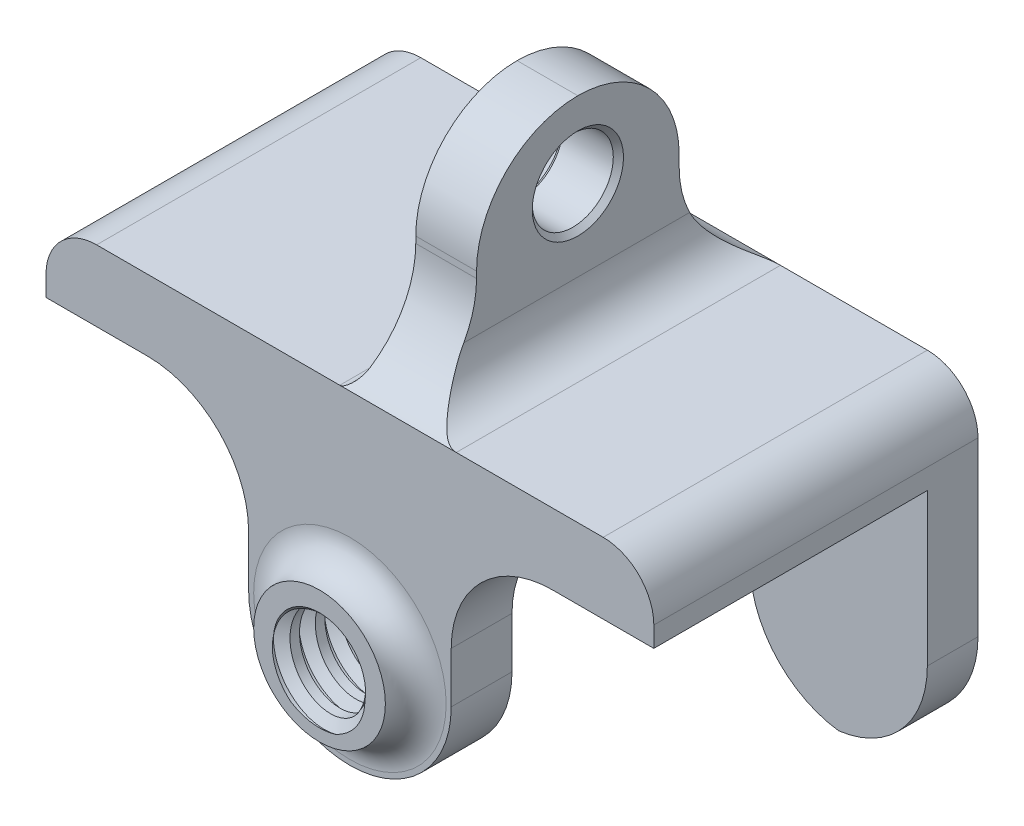
from build123d import *

# Parameters (mm, degrees)
BOSS_EXTRUDE1_DEPTH    = 60
SKETCH2_W              = 6
SKETCH2_H              = 20
BOSS_EXTRUDE3_DEPTH    = 20
FILLET1_R              = 10
SKETCH11_R             = 6.5
BOSS_EXTRUDE4_DEPTH    = 3
SKETCH15_R             = 3.75
CUT_EXTRUDE3_DEPTH     = 9
CHAMFER3_SIZE          = 0.8
CUT_SWEEP1_PITCH       = 2.5
M10X1_5_TAPPED_HOLE1_D = 8.5
FILLET7_R              = 3
M8X1_25_TAPPED_HOLE1_D = 8
CHAMFER2_SIZE          = 0.5
SKETCH9_W              = 20
SKETCH9_H              = 25
CUT_EXTRUDE1_DEPTH     = 6
FILLET3_R              = 10
SKETCH10_W             = 25
SKETCH10_H             = 25
CUT_EXTRUDE2_DEPTH     = 5
FILLET4_R              = 10
FILLET5_R              = 5
FILLET6_R              = 1
FILLET8_R              = 4.5


with BuildPart() as part:
    # Sketch1 → Boss-Extrude1 (new body)
    with BuildSketch(Plane(origin=(0, 0, 0), x_dir=(0, 0, -1), z_dir=(1, 0, 0))):
        Polygon((10.5, 0), (15.5, 0), (15.5, 32), (-16.5, 32), (-16.5, 0), (-10.5, 0), (-10.5, 25), (10.5, 25), align=None)
    extrude(amount=BOSS_EXTRUDE1_DEPTH)

    # Sketch2 → Boss-Extrude3 (add)
    with BuildSketch(Plane(origin=(0, 32, 0), x_dir=(1, 0, 0), z_dir=(0, 1, 0))):
        with Locations((33, 0)):
            Rectangle(SKETCH2_W, SKETCH2_H)
    extrude(amount=BOSS_EXTRUDE3_DEPTH)

    # Fillet1
    # the kernel refuses this fillet: 10 mm, written as the material it adds along each edge
    with BuildSketch(Plane(origin=(36, 32, -10), x_dir=(0, 0, -1), z_dir=(-1, 0, 0))) as fillet1_piece_1:
        with BuildLine():
            CenterArc((10, -8.93028555), FILLET1_R, 116.74368395, 63.25631605)
            Line((0, -8.93028555), (0, 0))
            Line((0, 0), (5.5, 0))
        make_face()
    extrude(amount=6)
    with BuildSketch(Plane(origin=(30, 32, 10), x_dir=(0, 0, 1), z_dir=(1, 0, 0))) as fillet1_piece_2:
        with BuildLine():
            CenterArc((10, -9.367496998), FILLET1_R, 110.487315115, 69.512684885)
            Line((0, -9.367496998), (0, 0))
            Line((0, 0), (6.5, 0))
        make_face()
    extrude(amount=6)
    # the kernel refuses this fillet: 10 mm, written as the material it takes off along each edge
    with BuildSketch(Plane(origin=(5, 52, 10), x_dir=(0, 0, -1), z_dir=(1, 0, 0))) as fillet1_2_piece_1:
        with BuildLine():
            CenterArc((FILLET1_R, -FILLET1_R), FILLET1_R, 90, 90)
            Line((0, -FILLET1_R), (0, 0))
            Line((0, 0), (FILLET1_R, 0))
        make_face()
    extrude(amount=56, mode=Mode.SUBTRACT)
    with BuildSketch(Plane(origin=(61, 52, -10), x_dir=(0, -1, 0), z_dir=(-1, 0, 0))) as fillet1_2_piece_2:
        with BuildLine():
            CenterArc((FILLET1_R, FILLET1_R), FILLET1_R, 180, 90)
            Line((0, FILLET1_R), (0, 0))
            Line((0, 0), (FILLET1_R, 0))
        make_face()
    extrude(amount=56, mode=Mode.SUBTRACT)

    # Sketch11 → Boss-Extrude4 (add)
    with BuildSketch(Plane.XY.offset(16.5)):
        with Locations(Location((30, 10, 0), (0, 0, 180))):
            Circle(SKETCH11_R)
    extrude(amount=BOSS_EXTRUDE4_DEPTH)

    # Sketch15 → Cut-Extrude3 (cut)
    with BuildSketch(Plane.XY.offset(19.5)):
        with Locations((30, 10)):
            Circle(SKETCH15_R)
    extrude(amount=-CUT_EXTRUDE3_DEPTH, mode=Mode.SUBTRACT)

    # Chamfer3
    chamfer3_edges = [part.edges().sort_by_distance(p)[0] for p in [
        (26.25, 10, 10.5),
        (26.25, 10, 19.5),
    ]]
    chamfer(chamfer3_edges, length=CHAMFER3_SIZE)

    # Cut-Sweep1: arcs per turn and ends read off the stored shape
    # Cut-Sweep1: the profile of Sketch17 screwed along a right-hand helix through 6 turns, 10 arcs to a turn; built about Z, then put on its axis
    cut_sweep1_z = Axis((0, 0, 0), (0, 0, 1))
    cut_sweep1_corners = [(3.74766594, 3.74766594, -1.126794919), (3.74766594, 3.74766594, -1.473205081), (2.367629642, 2.367629642, -2.6), (2.367629642, 2.367629642, 0)]
    with BuildLine(mode=Mode.PRIVATE) as cut_sweep1_profile:
        Line(cut_sweep1_corners[0], cut_sweep1_corners[1])
        Line(cut_sweep1_corners[1], cut_sweep1_corners[2])
        Line(cut_sweep1_corners[2], cut_sweep1_corners[3])
        Line(cut_sweep1_corners[3], cut_sweep1_corners[0])
    cut_sweep1_cap = Face(cut_sweep1_profile.wire())
    cut_sweep1_turn_angles = [0, 18, 36, 54, 72, 90, 108, 126, 144, 162, 180, 198, 216, 234, 252, 270, 288, 306, 324, 342, 360]
    cut_sweep1_turn_weights = [1, 0.9510565162951535, 1, 0.9510565162951535, 1, 0.9510565162951535, 1, 0.9510565162951535, 1, 0.9510565162951535, 1, 0.9510565162951535, 1, 0.9510565162951535, 1, 0.9510565162951535, 1, 0.9510565162951535, 1, 0.9510565162951535, 1]
    cut_sweep1_turn_rails = [Edge.make_bspline([Vector(p[0], p[1], 0).rotate(cut_sweep1_z, cut_sweep1_turn_angles[k]) / cut_sweep1_turn_weights[k] + Vector(0, 0, p[2] + CUT_SWEEP1_PITCH * cut_sweep1_turn_angles[k] / 360) for k in range(21)], [0, 0, 0, 1, 1, 2, 2, 3, 3, 4, 4, 5, 5, 6, 6, 7, 7, 8, 8, 9, 9, 10, 10, 10], 2, cut_sweep1_turn_weights) for p in cut_sweep1_corners]
    cut_sweep1_turn_sides = [Face.make_surface_from_curves(cut_sweep1_turn_rails[p[0]], cut_sweep1_turn_rails[p[1]]) for p in [(0, 1), (1, 2), (2, 3), (3, 0)]]
    cut_sweep1 = Plane(origin=(30, 10, 19.5), x_dir=(-0.7071067811865511, 0.7071067811865439, 0), z_dir=(0, 0, -1)) * Solid(Shell([*[p.moved(Location((0, 0, CUT_SWEEP1_PITCH * i))) for i in range(6) for p in cut_sweep1_turn_sides], cut_sweep1_cap, cut_sweep1_cap.rotate(cut_sweep1_z, 2160).moved(Location((0, 0, CUT_SWEEP1_PITCH * 2160 / 360)))]))
    add(cut_sweep1, mode=Mode.SUBTRACT)

    # M10x1.5 Tapped Hole1 (through all)
    with Locations(Plane.XY.offset(19.5)):
        with Locations((30, 10)):
            Hole(M10X1_5_TAPPED_HOLE1_D / 2)

    # Fillet7
    fillet7_edges = [part.edges().sort_by_distance(p)[0] for p in [
        (36.5, 10, 16.5),
    ]]
    fillet(fillet7_edges, radius=FILLET7_R - 0.0001)  # a hair under: the kernel refuses the full size

    # M8x1.25 Tapped Hole1 (through all)
    with Locations(Plane(origin=(36, 0, 0), x_dir=(0, 0, -1), z_dir=(1, 0, 0))):
        with Locations((0, 44.5)):
            Hole(M8X1_25_TAPPED_HOLE1_D / 2)

    # Chamfer2
    chamfer2_edges = [part.edges().sort_by_distance(p)[0] for p in [
        (30, 44.5, -4),
        (36, 44.5, -4),
    ]]
    chamfer(chamfer2_edges, length=CHAMFER2_SIZE)

    # Sketch9 → Cut-Extrude1 (cut)
    with BuildSketch(Plane.XY.offset(16.5)):
        with Locations((10, 12.5)):
            Rectangle(SKETCH9_W, SKETCH9_H)
        with Locations((50, 12.5)):
            Rectangle(SKETCH9_W, SKETCH9_H)
    extrude(amount=-CUT_EXTRUDE1_DEPTH, mode=Mode.SUBTRACT)

    # Fillet3
    # the kernel refuses this fillet: 10 mm, written as the material it adds along each edge
    with BuildSketch(Plane(origin=(40, 25, 16.5), x_dir=(0, -1, 0), z_dir=(0, 0, -1)), Plane(origin=(20, 25, 16.5), x_dir=(-1, 0, 0), z_dir=(0, 0, -1))) as fillet3_piece_1:
        with BuildLine():
            CenterArc((FILLET3_R, -FILLET3_R), FILLET3_R, 90, 90)
            Line((0, -FILLET3_R), (0, 0))
            Line((0, 0), (FILLET3_R, 0))
        make_face()
    extrude(amount=6)
    # the kernel refuses this fillet: 10 mm, written as the material it takes off along each edge
    with BuildSketch(Plane(origin=(40, 0, 41.5), x_dir=(-1, 0, 0), z_dir=(0, 0, -1)), Plane(origin=(20, 0, 41.5), x_dir=(0, 1, 0), z_dir=(0, 0, -1))) as fillet3_2_piece_1:
        with BuildLine():
            CenterArc((FILLET3_R, FILLET3_R), FILLET3_R, 180, 90)
            Line((0, FILLET3_R), (0, 0))
            Line((0, 0), (FILLET3_R, 0))
        make_face()
    extrude(amount=31, mode=Mode.SUBTRACT)

    # Sketch10 → Cut-Extrude2 (cut)
    with BuildSketch(Plane(origin=(0, 0, -15.5), x_dir=(-1, 0, 0), z_dir=(0, 0, -1))):
        with Locations((-30, 12.5)):
            Rectangle(SKETCH10_W, SKETCH10_H)
    extrude(amount=-CUT_EXTRUDE2_DEPTH, mode=Mode.SUBTRACT)

    # Fillet4
    # the kernel refuses this fillet: 10 mm, written as the material it adds along each edge
    with BuildSketch(Plane(origin=(42.5, 25, -15.5), x_dir=(-1, 0, 0), z_dir=(0, 0, 1))) as fillet4_piece_1:
        with BuildLine():
            CenterArc((FILLET4_R, FILLET4_R), FILLET4_R, 180, 90)
            Line((0, FILLET4_R), (0, 0))
            Line((0, 0), (FILLET4_R, 0))
        make_face()
    extrude(amount=5)
    with BuildSketch(Plane(origin=(17.5, 25, -15.5), x_dir=(1, 0, 0), z_dir=(0, 0, 1))) as fillet4_piece_2:
        with BuildLine():
            CenterArc((FILLET4_R, -FILLET4_R), FILLET4_R, 90, 90)
            Line((0, -FILLET4_R), (0, 0))
            Line((0, 0), (FILLET4_R, 0))
        make_face()
    extrude(amount=5)
    # the kernel refuses this fillet: 10 mm, written as the material it takes off along each edge
    with BuildSketch(Plane(origin=(0, 0, 14.5), x_dir=(0, 1, 0), z_dir=(0, 0, -1)), Plane(origin=(42.5, 0, -40.5), x_dir=(1, 0, 0), z_dir=(0, 0, 1)), Plane(origin=(60, 0, 14.5), x_dir=(-1, 0, 0), z_dir=(0, 0, -1)), Plane(origin=(17.5, 0, -40.5), x_dir=(0, 1, 0), z_dir=(0, 0, 1))) as fillet4_2_piece_1:
        with BuildLine():
            CenterArc((FILLET4_R, FILLET4_R), FILLET4_R, 180, 90)
            Line((0, FILLET4_R), (0, 0))
            Line((0, 0), (FILLET4_R, 0))
        make_face()
    extrude(amount=55, mode=Mode.SUBTRACT)

    # Fillet5
    fillet5_edges = [part.edges().sort_by_distance(p)[0] for p in [
        (60, 32, 0.5),
        (0, 32, 0.5),
    ]]
    fillet(fillet5_edges, radius=FILLET5_R)

    # Fillet6
    # the kernel refuses this fillet: 1 mm, written as the material it adds along each edge
    with BuildSketch(Plane(origin=(30, 32, -15.5), x_dir=(-1, 0, 0), z_dir=(0, 0, 1))) as fillet6_piece_1_section:
        with BuildLine():
            CenterArc((FILLET6_R, -FILLET6_R), FILLET6_R, 90, 90)
            Line((0, -FILLET6_R), (0, 0))
            Line((0, 0), (FILLET6_R, 0))
        make_face()
    fillet6_piece_1 = extrude(amount=32, mode=Mode.PRIVATE)
    fillet6_piece_1 = fillet6_piece_1 - Plane(origin=(30, 40.93028555, -20), x_dir=(0, 0, -1), z_dir=(1, 0, 0)) * Cylinder(10, 68, mode=Mode.PRIVATE)
    fillet6_piece_1 = fillet6_piece_1 - Plane(origin=(30, 41.367496998, 20), x_dir=(0, 0, 1), z_dir=(-1, 0, 0)) * Cylinder(10, 68, mode=Mode.PRIVATE)
    add(fillet6_piece_1)

    # Fillet8
    # the kernel refuses this fillet: 4.5 mm, written as the material it adds along each edge
    with BuildSketch(Plane(origin=(36, 32, 16.5), x_dir=(1, 0, 0), z_dir=(0, 0, -1))) as fillet8_piece_1_section:
        with BuildLine():
            CenterArc((FILLET8_R, -FILLET8_R), FILLET8_R, 90, 90)
            Line((0, -FILLET8_R), (0, 0))
            Line((0, 0), (FILLET8_R, 0))
        make_face()
    fillet8_piece_1 = extrude(amount=32, mode=Mode.PRIVATE)
    fillet8_piece_1 = fillet8_piece_1 - Plane(origin=(36, 41.367496998, 20), x_dir=(0, 0, 1), z_dir=(-1, 0, 0)) * Cylinder(10, 82, mode=Mode.PRIVATE)
    fillet8_piece_1 = fillet8_piece_1 - Plane(origin=(36, 40.93028555, -20), x_dir=(0, 0, -1), z_dir=(1, 0, 0)) * Cylinder(10, 82, mode=Mode.PRIVATE)
    add(fillet8_piece_1)


solid = part.part
